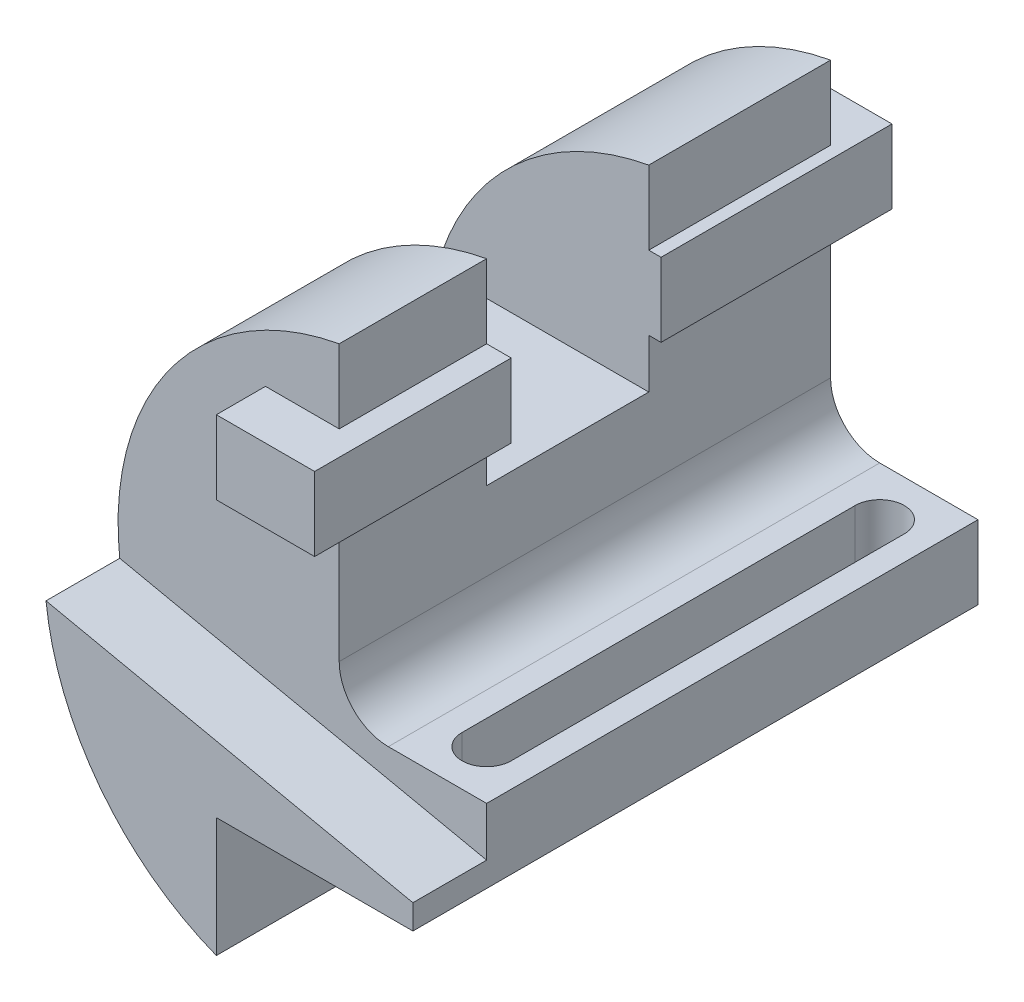
from build123d import *

# Parameters (mm, degrees)
BOSS_EXTRUDE1_DEPTH = 100
CUT_EXTRUDE1_REACH  = 124.27
SKETCH4_W           = 33
SKETCH4_H           = 40
SKETCH5_W           = 40
SKETCH5_H           = 15
BOSS_EXTRUDE2_DEPTH = 15
SKETCH6_W           = 40
SKETCH6_H           = 15
CUT_EXTRUDE2_DEPTH  = 10
SKETCH7_W           = 47
SKETCH7_H           = 15
BOSS_EXTRUDE3_DEPTH = 2.5
SKETCH8_W           = 47
SKETCH8_H           = 15
BOSS_EXTRUDE4_DEPTH = 20
CUT_EXTRUDE3_DEPTH  = 140.574352945
BOSS_EXTRUDE5_DEPTH = 15


with BuildPart() as part:
    # Sketch1 → Boss-Extrude1 (new body)
    with BuildSketch(Plane.XY):
        with BuildLine():
            Line((-10, 54.083269132), (-10, -1.916730868))
            ThreePointArc((-10, -1.916730868), (-7.071067812, -8.98779868), (0, -11.916730868))
            Line((0, -11.916730868), (20, -11.916730868))
            Line((20, -11.916730868), (20, -26.916730868))
            Line((20, -26.916730868), (-20, -26.916730868))
            Line((-20, -26.916730868), (-20, -51.23475383))
            ThreePointArc((-20, -51.23475383), (-54.753734942, 5.198895061), (-10, 54.083269132))
        make_face()
    extrude(amount=BOSS_EXTRUDE1_DEPTH)

    # Sketch4 → Cut-Extrude1 (cut, up to next)
    with BuildSketch(Plane(origin=(-10, 0, 0), x_dir=(0, 0, -1), z_dir=(1, 0, 0)), mode=Mode.PRIVATE) as cut_extrude1_sk1:
        with Locations((-53.5, 34.083269132)):
            Rectangle(SKETCH4_W, SKETCH4_H)
    cut_extrude1_tool1 = extrude(cut_extrude1_sk1.sketch, amount=-CUT_EXTRUDE1_REACH, mode=Mode.PRIVATE) & part.part
    add(cut_extrude1_tool1.solids().sort_by_distance((-10, 34.083269, 53.5))[0], mode=Mode.SUBTRACT)

    # Sketch5 → Boss-Extrude2 (add, symmetric)
    with BuildSketch(Plane(origin=(-10, 0, 0), x_dir=(0, 0, -1), z_dir=(1, 0, 0))):
        with Locations((-90, 31.583269132)):
            Rectangle(SKETCH5_W, SKETCH5_H)
    extrude(amount=BOSS_EXTRUDE2_DEPTH, both=True)

    # Sketch6 → Cut-Extrude2 (cut)
    with BuildSketch(Plane(origin=(5, 0, 0), x_dir=(0, 0, -1), z_dir=(1, 0, 0))):
        with Locations((-90, 31.583269132)):
            Rectangle(SKETCH6_W, SKETCH6_H)
    extrude(amount=-CUT_EXTRUDE2_DEPTH, mode=Mode.SUBTRACT)

    # Sketch7 → Boss-Extrude3 (add, symmetric)
    with BuildSketch(Plane(origin=(-10, 0, 0), x_dir=(0, 0, -1), z_dir=(1, 0, 0))):
        with Locations((-13.5, 31.583269132)):
            Rectangle(SKETCH7_W, SKETCH7_H)
    extrude(amount=BOSS_EXTRUDE3_DEPTH, both=True)

    # Sketch8 → Boss-Extrude4 (add)
    with BuildSketch(Plane(origin=(-7.5, 0, 0), x_dir=(0, 0, -1), z_dir=(1, 0, 0))):
        with Locations((-13.5, 31.583269132)):
            Rectangle(SKETCH8_W, SKETCH8_H)
    extrude(amount=-BOSS_EXTRUDE4_DEPTH)

    # Sketch9 → Cut-Extrude3 (cut, through all)
    with BuildSketch(Plane(origin=(0, -11.916730868, 0), x_dir=(1, 0, 0), z_dir=(0, 1, 0))):
        with BuildLine():
            Line((15, -10), (15, -90))
            ThreePointArc((15, -90), (10, -95), (5, -90))
            Line((5, -90), (5, -10))
            ThreePointArc((5, -10), (10, -5), (15, -10))
        make_face()
    extrude(amount=-CUT_EXTRUDE3_DEPTH, mode=Mode.SUBTRACT)

    # Sketch10 → Boss-Extrude5 (add)
    with BuildSketch(Plane.XY.offset(100)):
        with BuildLine():
            Line((20, -26.916730868), (20, -21.916730868))
            Line((20, -21.916730868), (-54.666698166, -6.045834235))
            ThreePointArc((-54.666698166, -6.045834235), (-43.638154949, -33.477028433), (-20, -51.23475383))
            Line((-20, -51.23475383), (-20, -26.916730868))
            Line((-20, -26.916730868), (20, -26.916730868))
        make_face()
    extrude(amount=BOSS_EXTRUDE5_DEPTH)


solid = part.part
